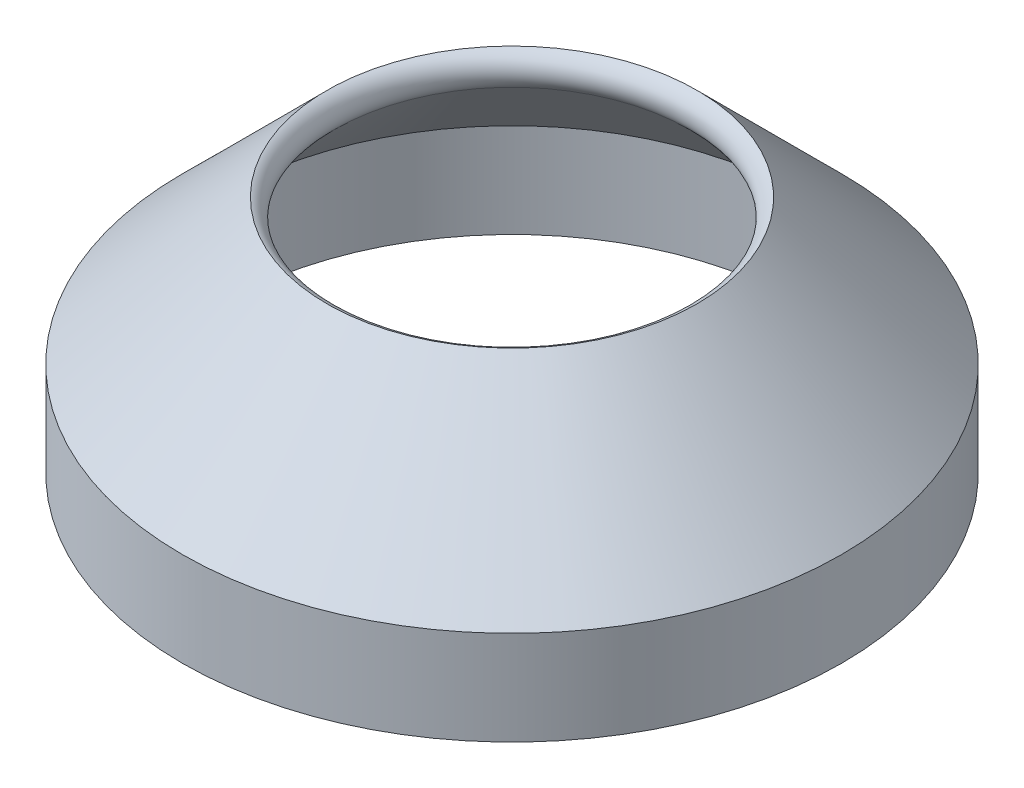
from build123d import *

# Parameters (mm, degrees)
FILLET1_R          = 2
SKETCH3_R          = 1.15
CUT_EXTRUDE1_DEPTH = 10
CIRPATTERN1_COUNT  = 4


with BuildPart() as part:
    # Sketch2 → Revolve1 (revolve)
    with BuildSketch(Plane.XY, mode=Mode.PRIVATE) as revolve1_sk:
        Polygon((-31, 0), (-31, 10), (-15.639434665, 25.360565335), (-19.639434665, 25.360565335), (-35, 10), (-35, 0), align=None)
    revolve(revolve1_sk.sketch.rotate(Axis((0, 0, 0), (0, 1, 0)), 180), axis=Axis((0, 0, 0), (0, 1, 0)))

    # Fillet1
    # the kernel refuses this fillet: 2 mm, written as the material it takes off along each edge
    with BuildSketch(Plane(origin=(0, 25.360565335, 0), x_dir=(1, 0, 0), z_dir=(0, 0, 1))) as fillet1_piece_1:
        with BuildLine():
            CenterArc((20.340836733, -1.872974943), FILLET1_R, 110.530199479, 114.469800521)
            Line((19.639434665, 0), (19.625406624, 0.037459499))
            ThreePointArc((19.625406624, 0.037459499), (17.639434665, 0.04), (15.639434665, 0.04))
            Line((15.639434665, 0.04), (15.611150394, -0.028284271))
            Line((15.611150394, -0.028284271), (18.8983389, -3.315472777))
            Line((18.8983389, -3.315472777), (18.926623171, -3.287188506))
        make_face()
    revolve(axis=Axis((0, 25.360565335, 0), (0, 1, 0)), mode=Mode.SUBTRACT)

    # Sketch3 → Cut-Extrude1 (cut)
    with BuildSketch(Plane.XZ):
        with Locations(Location((0, 33, 0), (0, 0, 270))):
            Circle(SKETCH3_R)
    cut_extrude1 = extrude(amount=-CUT_EXTRUDE1_DEPTH, mode=Mode.SUBTRACT)

    # CirPattern1: Cut-Extrude1 ×4 about axis
    cirpattern1_axis = Axis((0, 0, 0), (0, 1, 0))
    for i in range(1, CIRPATTERN1_COUNT):
        add(cut_extrude1.rotate(cirpattern1_axis, i * 360 / CIRPATTERN1_COUNT), mode=Mode.SUBTRACT)


solid = part.part
